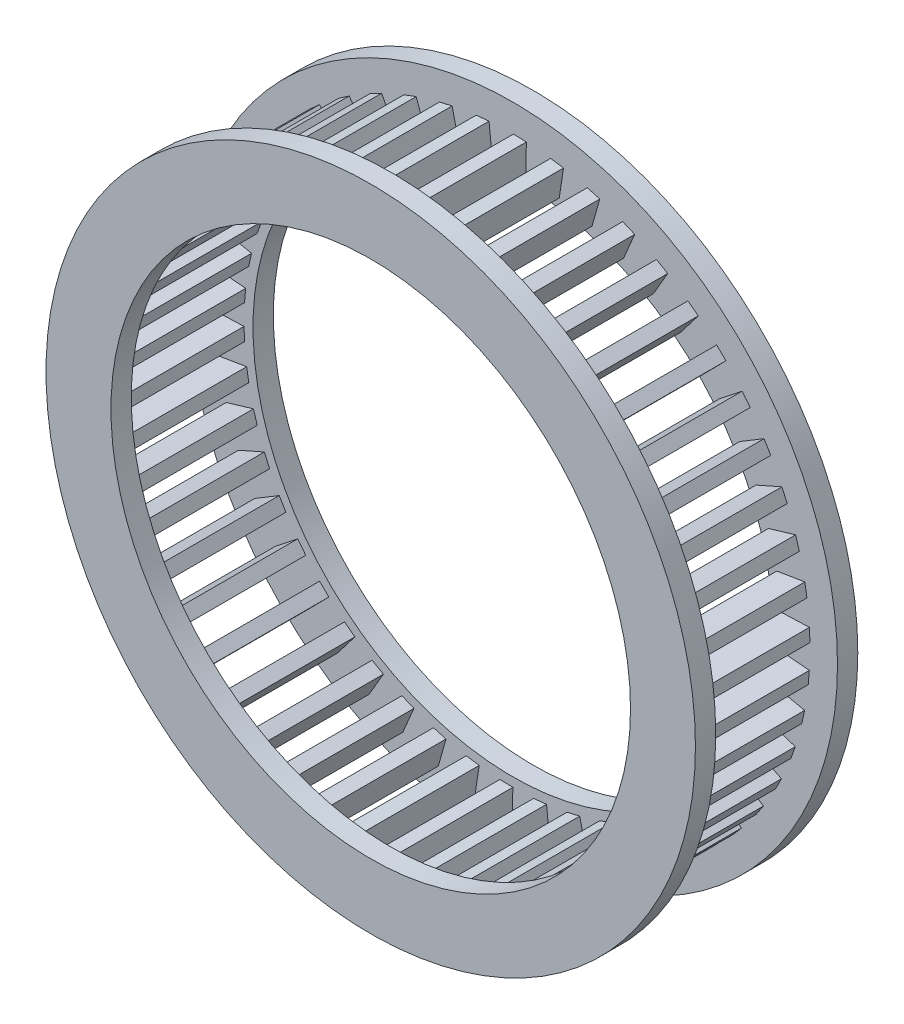
from build123d import *

# Parameters (mm, degrees)
CAGE_50_BARS_START    = -15.1
CAGE_50_BARS_DEPTH    = 30.2
CAGE_50_BARS_2_DEPTH  = 30.2
CAGE_50_BARS_3_DEPTH  = 30.2
CAGE_50_BARS_4_DEPTH  = 30.2
CAGE_50_BARS_5_DEPTH  = 30.2
CAGE_50_BARS_6_DEPTH  = 30.2
CAGE_50_BARS_7_DEPTH  = 30.2
CAGE_50_BARS_8_DEPTH  = 30.2
CAGE_50_BARS_9_DEPTH  = 30.2
CAGE_50_BARS_10_DEPTH = 30.2
CAGE_50_BARS_11_DEPTH = 30.2
CAGE_50_BARS_12_DEPTH = 30.2
CAGE_50_BARS_13_DEPTH = 30.2
CAGE_50_BARS_14_DEPTH = 30.2
CAGE_50_BARS_15_DEPTH = 30.2
CAGE_50_BARS_16_DEPTH = 30.2
CAGE_50_BARS_17_DEPTH = 30.2
CAGE_50_BARS_18_DEPTH = 30.2
CAGE_50_BARS_19_DEPTH = 30.2
CAGE_50_BARS_20_DEPTH = 30.2
CAGE_50_BARS_21_DEPTH = 30.2
CAGE_50_BARS_22_DEPTH = 30.2
CAGE_50_BARS_23_DEPTH = 30.2
CAGE_50_BARS_24_DEPTH = 30.2
CAGE_50_BARS_25_DEPTH = 30.2
CAGE_50_BARS_26_DEPTH = 30.2
CAGE_50_BARS_27_DEPTH = 30.2
CAGE_50_BARS_28_DEPTH = 30.2
CAGE_50_BARS_29_DEPTH = 30.2
CAGE_50_BARS_30_DEPTH = 30.2
CAGE_50_BARS_31_DEPTH = 30.2
CAGE_50_BARS_32_DEPTH = 30.2
CAGE_50_BARS_33_DEPTH = 30.2
CAGE_50_BARS_34_DEPTH = 30.2
CAGE_50_BARS_35_DEPTH = 30.2
CAGE_50_BARS_36_DEPTH = 30.2
CAGE_50_BARS_37_DEPTH = 30.2
CAGE_50_BARS_38_DEPTH = 30.2
CAGE_50_BARS_39_DEPTH = 30.2
CAGE_50_BARS_40_DEPTH = 30.2
CAGE_50_BARS_41_DEPTH = 30.2
CAGE_50_BARS_42_DEPTH = 30.2
CAGE_50_BARS_43_DEPTH = 30.2
CAGE_50_BARS_44_DEPTH = 30.2
CAGE_50_BARS_45_DEPTH = 30.2
CAGE_50_BARS_46_DEPTH = 30.2
CAGE_50_BARS_47_DEPTH = 30.2
CAGE_50_BARS_48_DEPTH = 30.2
CAGE_50_BARS_49_DEPTH = 30.2
CAGE_50_BARS_50_DEPTH = 30.2
CAGE_RING_RIGHT_START = 15
SKETCH_2_R            = 80
SKETCH_2_R_2          = 64
CAGE_RING_RIGHT_DEPTH = 5
CAGE_RING_LEFT_START  = -20
SKETCH_3_R            = 80
SKETCH_3_R_2          = 64
CAGE_RING_LEFT_DEPTH  = 5


with BuildPart() as part:
    # Эскиз1 → Cage_50_bars (new body)
    with BuildSketch(Plane.XY.offset(CAGE_50_BARS_START)):
        Polygon((66.212088869, 0.979432253), (73.206778115, 1.25205353), (73.082151245, 4.449625757), (66.087462, 4.177004479), align=None)
    extrude(amount=CAGE_50_BARS_DEPTH)



with BuildPart() as body_2:
    # Эскиз1 → Cage_50_bars 2 (new body)
    with BuildSketch(Plane.XY.offset(CAGE_50_BARS_START)):
        Polygon((65.567231361, 9.270284336), (72.472596886, 10.417422934), (71.94819067, 13.57416146), (65.042825145, 12.427022862), align=None)
    extrude(amount=CAGE_50_BARS_2_DEPTH)


with BuildPart() as body_3:
    # Эскиз1 → Cage_50_bars 3 (new body)
    with BuildSketch(Plane.XY.offset(CAGE_50_BARS_START)):
        Polygon((63.888339446, 17.414938497), (70.595479511, 19.418503355), (69.679564148, 22.484624528), (62.972424082, 20.48105967), align=None)
    extrude(amount=CAGE_50_BARS_3_DEPTH)


with BuildPart() as body_4:
    # Эскиз1 → Cage_50_bars 4 (new body)
    with BuildSketch(Plane.XY.offset(CAGE_50_BARS_START)):
        Polygon((61.201890252, 25.284948676), (67.605029253, 28.113342378), (66.312049275, 31.040491636), (59.908910274, 28.212097933), align=None)
    extrude(amount=CAGE_50_BARS_4_DEPTH)


with BuildPart() as body_5:
    # Эскиз1 → Cage_50_bars 5 (new body)
    with BuildSketch(Plane.XY.offset(CAGE_50_BARS_START)):
        Polygon((57.55025069, 32.756200109), (63.548407298, 36.364817198), (61.898753772, 39.106831648), (55.900597163, 35.498214558), align=None)
    extrude(amount=CAGE_50_BARS_5_DEPTH)


with BuildPart() as body_6:
    # Эскиз1 → Cage_50_bars 6 (new body)
    with BuildSketch(Plane.XY.offset(CAGE_50_BARS_START)):
        Polygon((52.991009295, 39.710866698), (58.489588998, 44.042797127), (56.509277945, 46.556433563), (51.010698241, 42.224503134), align=None)
    extrude(amount=CAGE_50_BARS_6_DEPTH)


with BuildPart() as body_7:
    # Эскиз1 → Cage_50_bars 7 (new body)
    with BuildSketch(Plane.XY.offset(CAGE_50_BARS_START)):
        Polygon((47.596068028, 46.039269198), (52.50835494, 51.026195836), (50.228617048, 53.27181271), (45.316330136, 48.284886072), align=None)
    extrude(amount=CAGE_50_BARS_7_DEPTH)


with BuildPart() as body_8:
    # Эскиз1 → Cage_50_bars 8 (new body)
    with BuildSketch(Plane.XY.offset(CAGE_50_BARS_START)):
        Polygon((41.450508336, 51.64160492), (45.699032757, 57.204880955), (43.155820855, 59.147063548), (38.907296434, 53.583787513), align=None)
    extrude(amount=CAGE_50_BARS_8_DEPTH)


with BuildPart() as body_9:
    # Эскиз1 → Cage_50_bars 9 (new body)
    with BuildSketch(Plane.XY.offset(CAGE_50_BARS_START)):
        Polygon((34.651249366, 56.429521683), (38.169009528, 62.481410929), (35.402431588, 64.08952986), (31.884671425, 58.037640615), align=None)
    extrude(amount=CAGE_50_BARS_9_DEPTH)


with BuildPart() as body_10:
    # Эскиз1 → Cage_50_bars 10 (new body)
    with BuildSketch(Plane.XY.offset(CAGE_50_BARS_START)):
        Polygon((27.305519494, 60.32751118), (30.037038218, 66.772571727), (27.090724825, 68.021266001), (24.359206101, 61.576205454), align=None)
    extrude(amount=CAGE_50_BARS_10_DEPTH)


with BuildPart() as body_11:
    # Эскиз1 → Cage_50_bars 11 (new body)
    with BuildSketch(Plane.XY.offset(CAGE_50_BARS_START)):
        Polygon((19.529165267, 63.274099788), (21.431364872, 70.010689182), (18.351781149, 70.880266144), (16.449581545, 64.14367675), align=None)
    extrude(amount=CAGE_50_BARS_11_DEPTH)


with BuildPart() as body_12:
    # Эскиз1 → Cage_50_bars 12 (new body)
    with BuildSketch(Plane.XY.offset(CAGE_50_BARS_START)):
        Polygon((11.444824439, 65.222818044), (12.4877061, 72.144696246), (9.323418922, 72.621442148), (8.280537261, 65.699563946), align=None)
    extrude(amount=CAGE_50_BARS_12_DEPTH)


with BuildPart() as body_13:
    # Эскиз1 → Cage_50_bars 13 (new body)
    with BuildSketch(Plane.XY.offset(CAGE_50_BARS_START)):
        Polygon((3.179991892, 66.142933497), (3.347108742, 73.140938352), (0.148020808, 73.217334627), (-0.019096042, 66.219329771), align=None)
    extrude(amount=CAGE_50_BARS_13_DEPTH)


with BuildPart() as body_14:
    # Эскиз1 → Cage_50_bars 14 (new body)
    with BuildSketch(Plane.XY.offset(CAGE_50_BARS_START)):
        Polygon((-5.134991026, 66.019935377), (-5.846274519, 72.983704169), (-9.029711682, 72.658546001), (-8.318428188, 65.694777209), align=None)
    extrude(amount=CAGE_50_BARS_14_DEPTH)


with BuildPart() as body_15:
    # Эскиз1 → Cage_50_bars 15 (new body)
    with BuildSketch(Plane.XY.offset(CAGE_50_BARS_START)):
        Polygon((-13.368992069, 64.855763438), (-14.94745854, 71.675473373), (-18.065040224, 70.9538887), (-16.486573753, 64.134178765), align=None)
    extrude(amount=CAGE_50_BARS_15_DEPTH)


with BuildPart() as body_16:
    # Эскиз1 → Cage_50_bars 16 (new body)
    with BuildSketch(Plane.XY.offset(CAGE_50_BARS_START)):
        Polygon((-21.39215612, 62.668777366), (-23.812912209, 69.236877544), (-26.815472291, 68.130246189), (-24.394716202, 61.562146011), align=None)
    extrude(amount=CAGE_50_BARS_16_DEPTH)


with BuildPart() as body_17:
    # Эскиз1 → Cage_50_bars 17 (new body)
    with BuildSketch(Plane.XY.offset(CAGE_50_BARS_START)):
        Polygon((-29.07795309, 59.493467239), (-32.302822029, 65.706374797), (-35.143008341, 64.232148997), (-31.918139403, 58.019241438), align=None)
    extrude(amount=CAGE_50_BARS_17_DEPTH)


with BuildPart() as body_18:
    # Эскиз1 → Cage_50_bars 18 (new body)
    with BuildSketch(Plane.XY.offset(CAGE_50_BARS_START)):
        Polygon((-36.30517337, 55.379909593), (-40.283297048, 61.139643268), (-42.916318156, 59.321072444), (-38.938194478, 53.561338769), align=None)
    extrude(amount=CAGE_50_BARS_18_DEPTH)


with BuildPart() as body_19:
    # Эскиз1 → Cage_50_bars 19 (new body)
    with BuildSketch(Plane.XY.offset(CAGE_50_BARS_START)):
        Polygon((-42.959839378, 50.392977692), (-47.628480408, 55.608703042), (-50.012811997, 53.474467142), (-45.344170967, 48.258741792), align=None)
    extrude(amount=CAGE_50_BARS_19_DEPTH)


with BuildPart() as body_20:
    # Эскиз1 → Cage_50_bars 20 (new body)
    with BuildSketch(Plane.XY.offset(CAGE_50_BARS_START)):
        Polygon((-48.937003056, 44.611318428), (-54.222534181, 49.20078035), (-56.320573916, 46.78453755), (-51.035042791, 42.195075628), align=None)
    extrude(amount=CAGE_50_BARS_20_DEPTH)


with BuildPart() as body_21:
    # Эскиз1 → Cage_50_bars 21 (new body)
    with BuildSketch(Plane.XY.offset(CAGE_50_BARS_START)):
        Polygon((-54.142400962, 38.126112024), (-59.961466198, 42.01693196), (-61.740126741, 39.356787852), (-55.921061505, 35.465967916), align=None)
    extrude(amount=CAGE_50_BARS_21_DEPTH)


with BuildPart() as body_22:
    # Эскиз1 → Cage_50_bars 22 (new body)
    with BuildSketch(Plane.XY.offset(CAGE_50_BARS_START)):
        Polygon((-58.493940862, 31.039634057), (-64.754770075, 34.170451454), (-66.186000885, 31.308358099), (-59.925171672, 28.177540703), align=None)
    extrude(amount=CAGE_50_BARS_22_DEPTH)


with BuildPart() as body_23:
    # Эскиз1 → Cage_50_bars 23 (new body)
    with BuildSketch(Plane.XY.offset(CAGE_50_BARS_START)):
        Polygon((-61.922996372, 23.463642519), (-68.526852545, 25.785082516), (-69.588082257, 22.766176837), (-62.984226085, 20.444736841), align=None)
    extrude(amount=CAGE_50_BARS_23_DEPTH)


with BuildPart() as body_24:
    # Эскиз1 → Cage_50_bars 24 (new body)
    with BuildSketch(Plane.XY.offset(CAGE_50_BARS_START)):
        Polygon((-64.375489239, 15.517615322), (-71.218225614, 16.993067423), (-71.892718002, 13.864959366), (-65.049981627, 12.389507265), align=None)
    extrude(amount=CAGE_50_BARS_24_DEPTH)


with BuildPart() as body_25:
    # Эскиз1 → Cage_50_bars 25 (new body)
    with BuildSketch(Plane.XY.offset(CAGE_50_BARS_START)):
        Polygon((-65.812742183, 7.326866062), (-72.786444721, 7.933061506), (-73.063562638, 4.745083203), (-66.089860101, 4.138887759), align=None)
    extrude(amount=CAGE_50_BARS_25_DEPTH)


with BuildPart() as body_26:
    # Эскиз1 → Cage_50_bars 26 (new body)
    with BuildSketch(Plane.XY.offset(CAGE_50_BARS_START)):
        Polygon((-66.212088869, -0.979432253), (-73.206778115, -1.25205353), (-73.082151245, -4.449625757), (-66.087462, -4.177004479), align=None)
    extrude(amount=CAGE_50_BARS_26_DEPTH)


with BuildPart() as body_27:
    # Эскиз1 → Cage_50_bars 27 (new body)
    with BuildSketch(Plane.XY.offset(CAGE_50_BARS_START)):
        Polygon((-65.567231361, -9.270284336), (-72.472596886, -10.417422934), (-71.94819067, -13.57416146), (-65.042825145, -12.427022862), align=None)
    extrude(amount=CAGE_50_BARS_27_DEPTH)


with BuildPart() as body_28:
    # Эскиз1 → Cage_50_bars 28 (new body)
    with BuildSketch(Plane.XY.offset(CAGE_50_BARS_START)):
        Polygon((-63.888339446, -17.414938497), (-70.595479511, -19.418503355), (-69.679564148, -22.484624528), (-62.972424082, -20.48105967), align=None)
    extrude(amount=CAGE_50_BARS_28_DEPTH)


with BuildPart() as body_29:
    # Эскиз1 → Cage_50_bars 29 (new body)
    with BuildSketch(Plane.XY.offset(CAGE_50_BARS_START)):
        Polygon((-61.201890252, -25.284948676), (-67.605029253, -28.113342378), (-66.312049275, -31.040491636), (-59.908910274, -28.212097933), align=None)
    extrude(amount=CAGE_50_BARS_29_DEPTH)


with BuildPart() as body_30:
    # Эскиз1 → Cage_50_bars 30 (new body)
    with BuildSketch(Plane.XY.offset(CAGE_50_BARS_START)):
        Polygon((-57.55025069, -32.756200109), (-63.548407298, -36.364817198), (-61.898753772, -39.106831648), (-55.900597163, -35.498214558), align=None)
    extrude(amount=CAGE_50_BARS_30_DEPTH)


with BuildPart() as body_31:
    # Эскиз1 → Cage_50_bars 31 (new body)
    with BuildSketch(Plane.XY.offset(CAGE_50_BARS_START)):
        Polygon((-52.991009295, -39.710866698), (-58.489588998, -44.042797127), (-56.509277945, -46.556433563), (-51.010698241, -42.224503134), align=None)
    extrude(amount=CAGE_50_BARS_31_DEPTH)


with BuildPart() as body_32:
    # Эскиз1 → Cage_50_bars 32 (new body)
    with BuildSketch(Plane.XY.offset(CAGE_50_BARS_START)):
        Polygon((-47.596068028, -46.039269198), (-52.50835494, -51.026195836), (-50.228617048, -53.27181271), (-45.316330136, -48.284886072), align=None)
    extrude(amount=CAGE_50_BARS_32_DEPTH)


with BuildPart() as body_33:
    # Эскиз1 → Cage_50_bars 33 (new body)
    with BuildSketch(Plane.XY.offset(CAGE_50_BARS_START)):
        Polygon((-41.450508336, -51.64160492), (-45.699032757, -57.204880955), (-43.155820855, -59.147063548), (-38.907296434, -53.583787513), align=None)
    extrude(amount=CAGE_50_BARS_33_DEPTH)


with BuildPart() as body_34:
    # Эскиз1 → Cage_50_bars 34 (new body)
    with BuildSketch(Plane.XY.offset(CAGE_50_BARS_START)):
        Polygon((-34.651249366, -56.429521683), (-38.169009528, -62.481410929), (-35.402431588, -64.08952986), (-31.884671425, -58.037640615), align=None)
    extrude(amount=CAGE_50_BARS_34_DEPTH)


with BuildPart() as body_35:
    # Эскиз1 → Cage_50_bars 35 (new body)
    with BuildSketch(Plane.XY.offset(CAGE_50_BARS_START)):
        Polygon((-27.305519494, -60.32751118), (-30.037038218, -66.772571727), (-27.090724825, -68.021266001), (-24.359206101, -61.576205454), align=None)
    extrude(amount=CAGE_50_BARS_35_DEPTH)


with BuildPart() as body_36:
    # Эскиз1 → Cage_50_bars 36 (new body)
    with BuildSketch(Plane.XY.offset(CAGE_50_BARS_START)):
        Polygon((-19.529165267, -63.274099788), (-21.431364872, -70.010689182), (-18.351781149, -70.880266144), (-16.449581545, -64.14367675), align=None)
    extrude(amount=CAGE_50_BARS_36_DEPTH)


with BuildPart() as body_37:
    # Эскиз1 → Cage_50_bars 37 (new body)
    with BuildSketch(Plane.XY.offset(CAGE_50_BARS_START)):
        Polygon((-11.444824439, -65.222818044), (-12.4877061, -72.144696246), (-9.323418922, -72.621442148), (-8.280537261, -65.699563946), align=None)
    extrude(amount=CAGE_50_BARS_37_DEPTH)


with BuildPart() as body_38:
    # Эскиз1 → Cage_50_bars 38 (new body)
    with BuildSketch(Plane.XY.offset(CAGE_50_BARS_START)):
        Polygon((-3.179991892, -66.142933497), (-3.347108742, -73.140938352), (-0.148020808, -73.217334627), (0.019096042, -66.219329771), align=None)
    extrude(amount=CAGE_50_BARS_38_DEPTH)


with BuildPart() as body_39:
    # Эскиз1 → Cage_50_bars 39 (new body)
    with BuildSketch(Plane.XY.offset(CAGE_50_BARS_START)):
        Polygon((5.134991026, -66.019935377), (5.846274519, -72.983704169), (9.029711682, -72.658546001), (8.318428188, -65.694777209), align=None)
    extrude(amount=CAGE_50_BARS_39_DEPTH)


with BuildPart() as body_40:
    # Эскиз1 → Cage_50_bars 40 (new body)
    with BuildSketch(Plane.XY.offset(CAGE_50_BARS_START)):
        Polygon((13.368992069, -64.855763438), (14.94745854, -71.675473373), (18.065040224, -70.9538887), (16.486573753, -64.134178765), align=None)
    extrude(amount=CAGE_50_BARS_40_DEPTH)


with BuildPart() as body_41:
    # Эскиз1 → Cage_50_bars 41 (new body)
    with BuildSketch(Plane.XY.offset(CAGE_50_BARS_START)):
        Polygon((21.39215612, -62.668777366), (23.812912209, -69.236877544), (26.815472291, -68.130246189), (24.394716202, -61.562146011), align=None)
    extrude(amount=CAGE_50_BARS_41_DEPTH)


with BuildPart() as body_42:
    # Эскиз1 → Cage_50_bars 42 (new body)
    with BuildSketch(Plane.XY.offset(CAGE_50_BARS_START)):
        Polygon((29.07795309, -59.493467239), (32.302822029, -65.706374797), (35.143008341, -64.232148997), (31.918139403, -58.019241438), align=None)
    extrude(amount=CAGE_50_BARS_42_DEPTH)


with BuildPart() as body_43:
    # Эскиз1 → Cage_50_bars 43 (new body)
    with BuildSketch(Plane.XY.offset(CAGE_50_BARS_START)):
        Polygon((36.30517337, -55.379909593), (40.283297048, -61.139643268), (42.916318156, -59.321072444), (38.938194478, -53.561338769), align=None)
    extrude(amount=CAGE_50_BARS_43_DEPTH)


with BuildPart() as body_44:
    # Эскиз1 → Cage_50_bars 44 (new body)
    with BuildSketch(Plane.XY.offset(CAGE_50_BARS_START)):
        Polygon((42.959839378, -50.392977692), (47.628480408, -55.608703042), (50.012811997, -53.474467142), (45.344170967, -48.258741792), align=None)
    extrude(amount=CAGE_50_BARS_44_DEPTH)


with BuildPart() as body_45:
    # Эскиз1 → Cage_50_bars 45 (new body)
    with BuildSketch(Plane.XY.offset(CAGE_50_BARS_START)):
        Polygon((48.937003056, -44.611318428), (54.222534181, -49.20078035), (56.320573916, -46.78453755), (51.035042791, -42.195075628), align=None)
    extrude(amount=CAGE_50_BARS_45_DEPTH)


with BuildPart() as body_46:
    # Эскиз1 → Cage_50_bars 46 (new body)
    with BuildSketch(Plane.XY.offset(CAGE_50_BARS_START)):
        Polygon((54.142400962, -38.126112024), (59.961466198, -42.01693196), (61.740126741, -39.356787852), (55.921061505, -35.465967916), align=None)
    extrude(amount=CAGE_50_BARS_46_DEPTH)


with BuildPart() as body_47:
    # Эскиз1 → Cage_50_bars 47 (new body)
    with BuildSketch(Plane.XY.offset(CAGE_50_BARS_START)):
        Polygon((58.493940862, -31.039634057), (64.754770075, -34.170451454), (66.186000885, -31.308358099), (59.925171672, -28.177540703), align=None)
    extrude(amount=CAGE_50_BARS_47_DEPTH)


with BuildPart() as body_48:
    # Эскиз1 → Cage_50_bars 48 (new body)
    with BuildSketch(Plane.XY.offset(CAGE_50_BARS_START)):
        Polygon((61.922996372, -23.463642519), (68.526852545, -25.785082516), (69.588082257, -22.766176837), (62.984226085, -20.444736841), align=None)
    extrude(amount=CAGE_50_BARS_48_DEPTH)


with BuildPart() as body_49:
    # Эскиз1 → Cage_50_bars 49 (new body)
    with BuildSketch(Plane.XY.offset(CAGE_50_BARS_START)):
        Polygon((64.375489239, -15.517615322), (71.218225614, -16.993067423), (71.892718002, -13.864959366), (65.049981627, -12.389507265), align=None)
    extrude(amount=CAGE_50_BARS_49_DEPTH)


with BuildPart() as body_50:
    # Эскиз1 → Cage_50_bars 50 (new body)
    with BuildSketch(Plane.XY.offset(CAGE_50_BARS_START)):
        Polygon((65.812742183, -7.326866062), (72.786444721, -7.933061506), (73.063562638, -4.745083203), (66.089860101, -4.138887759), align=None)
    extrude(amount=CAGE_50_BARS_50_DEPTH)


with BuildPart() as part_1:
    add(part.part)

    add(body_2.part)  # Cage_ring_right merges body 2

    add(body_3.part)  # Cage_ring_right merges body 3

    add(body_4.part)  # Cage_ring_right merges body 4

    add(body_5.part)  # Cage_ring_right merges body 5

    add(body_6.part)  # Cage_ring_right merges body 6

    add(body_7.part)  # Cage_ring_right merges body 7

    add(body_8.part)  # Cage_ring_right merges body 8

    add(body_9.part)  # Cage_ring_right merges body 9

    add(body_10.part)  # Cage_ring_right merges body 10

    add(body_11.part)  # Cage_ring_right merges body 11

    add(body_12.part)  # Cage_ring_right merges body 12

    add(body_13.part)  # Cage_ring_right merges body 13

    add(body_14.part)  # Cage_ring_right merges body 14

    add(body_15.part)  # Cage_ring_right merges body 15

    add(body_16.part)  # Cage_ring_right merges body 16

    add(body_17.part)  # Cage_ring_right merges body 17

    add(body_18.part)  # Cage_ring_right merges body 18

    add(body_19.part)  # Cage_ring_right merges body 19

    add(body_20.part)  # Cage_ring_right merges body 20

    add(body_21.part)  # Cage_ring_right merges body 21

    add(body_22.part)  # Cage_ring_right merges body 22

    add(body_23.part)  # Cage_ring_right merges body 23

    add(body_24.part)  # Cage_ring_right merges body 24

    add(body_25.part)  # Cage_ring_right merges body 25

    add(body_26.part)  # Cage_ring_right merges body 26

    add(body_27.part)  # Cage_ring_right merges body 27

    add(body_28.part)  # Cage_ring_right merges body 28

    add(body_29.part)  # Cage_ring_right merges body 29

    add(body_30.part)  # Cage_ring_right merges body 30

    add(body_31.part)  # Cage_ring_right merges body 31

    add(body_32.part)  # Cage_ring_right merges body 32

    add(body_33.part)  # Cage_ring_right merges body 33

    add(body_34.part)  # Cage_ring_right merges body 34

    add(body_35.part)  # Cage_ring_right merges body 35

    add(body_36.part)  # Cage_ring_right merges body 36

    add(body_37.part)  # Cage_ring_right merges body 37

    add(body_38.part)  # Cage_ring_right merges body 38

    add(body_39.part)  # Cage_ring_right merges body 39

    add(body_40.part)  # Cage_ring_right merges body 40

    add(body_41.part)  # Cage_ring_right merges body 41

    add(body_42.part)  # Cage_ring_right merges body 42

    add(body_43.part)  # Cage_ring_right merges body 43

    add(body_44.part)  # Cage_ring_right merges body 44

    add(body_45.part)  # Cage_ring_right merges body 45

    add(body_46.part)  # Cage_ring_right merges body 46

    add(body_47.part)  # Cage_ring_right merges body 47

    add(body_48.part)  # Cage_ring_right merges body 48

    add(body_49.part)  # Cage_ring_right merges body 49

    add(body_50.part)  # Cage_ring_right merges body 50
    # Эскиз2 → Cage_ring_right (add)
    with BuildSketch(Plane.XY.offset(CAGE_RING_RIGHT_START)):
        Circle(SKETCH_2_R)
        Circle(SKETCH_2_R_2, mode=Mode.SUBTRACT)
    extrude(amount=CAGE_RING_RIGHT_DEPTH)

    # Эскиз3 → Cage_ring_left (add)
    with BuildSketch(Plane.XY.offset(CAGE_RING_LEFT_START)):
        Circle(SKETCH_3_R)
        Circle(SKETCH_3_R_2, mode=Mode.SUBTRACT)
    extrude(amount=CAGE_RING_LEFT_DEPTH)


solid = part_1.part
